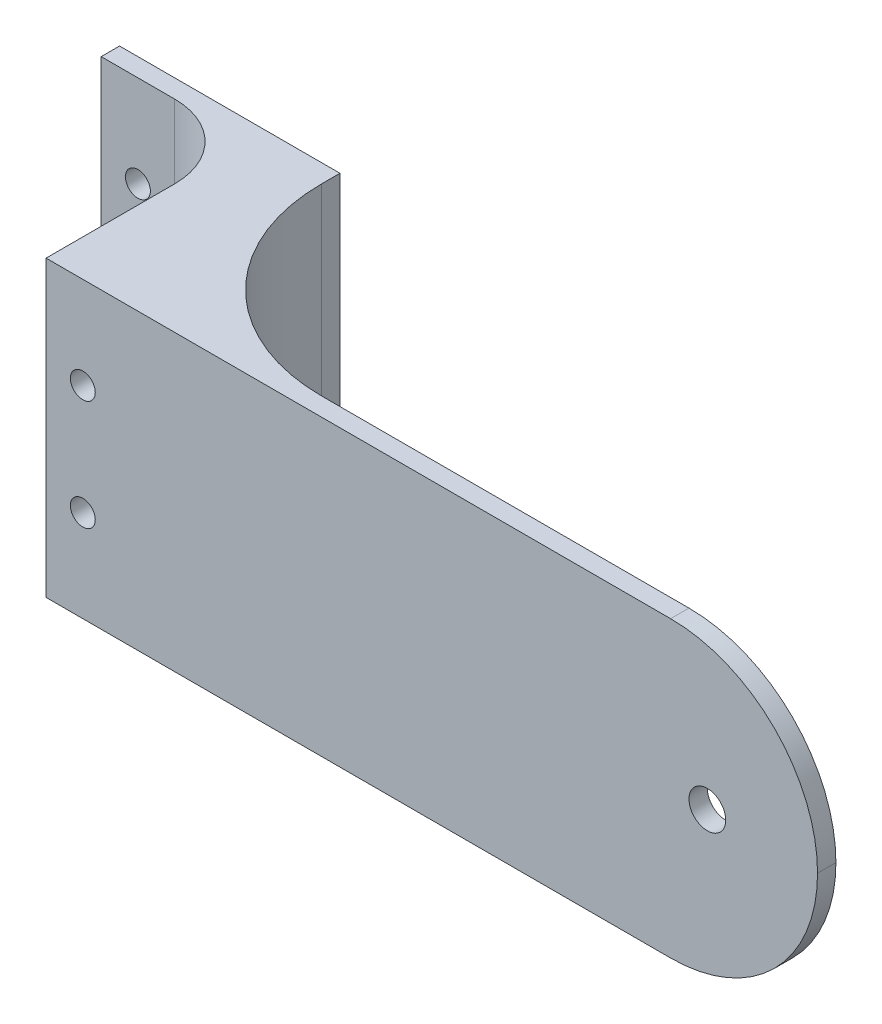
from build123d import *

# Parameters (mm, degrees)
BOSS_EXTRUDE1_DEPTH = 3.175
SKETCH2_W           = 12.7
SKETCH2_H           = 50.8
BOSS_EXTRUDE2_DEPTH = 31.75
FILLET1_R           = 12.7
BOSS_EXTRUDE3_DEPTH = 3.175
FILLET2_R           = 31.75
SKETCH4_R           = 2.15265
CUT_EXTRUDE1_DEPTH  = 38.1
FILLET3_R           = 25.4
CUT_EXTRUDE4_REACH  = 131.047
SKETCH7_R           = 3.175


with BuildPart() as part:
    # Sketch1 → Boss-Extrude1 (new body)
    with BuildSketch(Plane.XY.offset(15.875)):
        Polygon((-38.1, 25.4), (-38.1, -25.4), (-25.4, -25.4), (0, -25.4), (0, 25.4), align=None)
    extrude(amount=BOSS_EXTRUDE1_DEPTH)

    # Sketch2 → Boss-Extrude2 (add)
    with BuildSketch(Plane.XY.offset(50.8)):
        with Locations((-6.35, 0)):
            Rectangle(SKETCH2_W, SKETCH2_H)
    extrude(amount=-BOSS_EXTRUDE2_DEPTH)

    # Fillet1
    fillet1_edges = [part.edges().sort_by_distance(p)[0] for p in [
        (-12.7, 0, 19.05),
    ]]
    fillet(fillet1_edges, radius=FILLET1_R)

    # Sketch3 → Boss-Extrude3 (add)
    with BuildSketch(Plane.XY.offset(50.8)):
        Polygon((0, 25.4), (101.6, 25.4), (120.65, 25.4), (120.65, -25.4), (0, -25.4), (-12.7, -25.4), (-12.7, 25.4), align=None)
    extrude(amount=BOSS_EXTRUDE3_DEPTH)

    # Fillet2
    fillet2_edges = [part.edges().sort_by_distance(p)[0] for p in [
        (0, 0, 50.8),
    ]]
    fillet(fillet2_edges, radius=FILLET2_R)

    # Sketch4 → Cut-Extrude1 (cut)
    with BuildSketch(Plane.XY.offset(53.975)):
        with Locations((-6.35, 9.525)):
            Circle(SKETCH4_R)
        with Locations((-31.75, 9.525)):
            Circle(SKETCH4_R)
        with Locations((-6.35, -9.525)):
            Circle(SKETCH4_R)
        with Locations((-31.75, -9.525)):
            Circle(SKETCH4_R)
    extrude(amount=-CUT_EXTRUDE1_DEPTH, mode=Mode.SUBTRACT)

    # Fillet3
    fillet3_edges = [part.edges().sort_by_distance(p)[0] for p in [
        (120.65, -25.4, 52.3875),
        (120.65, 25.4, 52.3875),
    ]]
    fillet(fillet3_edges, radius=FILLET3_R - 0.0001)  # a hair under: the kernel refuses the full size

    # Sketch7 → Cut-Extrude4 (cut, up to next)
    with BuildSketch(Plane.XY.offset(53.975), mode=Mode.PRIVATE) as cut_extrude4_sk1:
        with Locations((101.6, 0)):
            Circle(SKETCH7_R)
    cut_extrude4_tool1 = extrude(cut_extrude4_sk1.sketch, amount=-CUT_EXTRUDE4_REACH, mode=Mode.PRIVATE) & part.part
    add(cut_extrude4_tool1.solids().sort_by_distance((101.6, 0, 53.975))[0], mode=Mode.SUBTRACT)


solid = part.part
